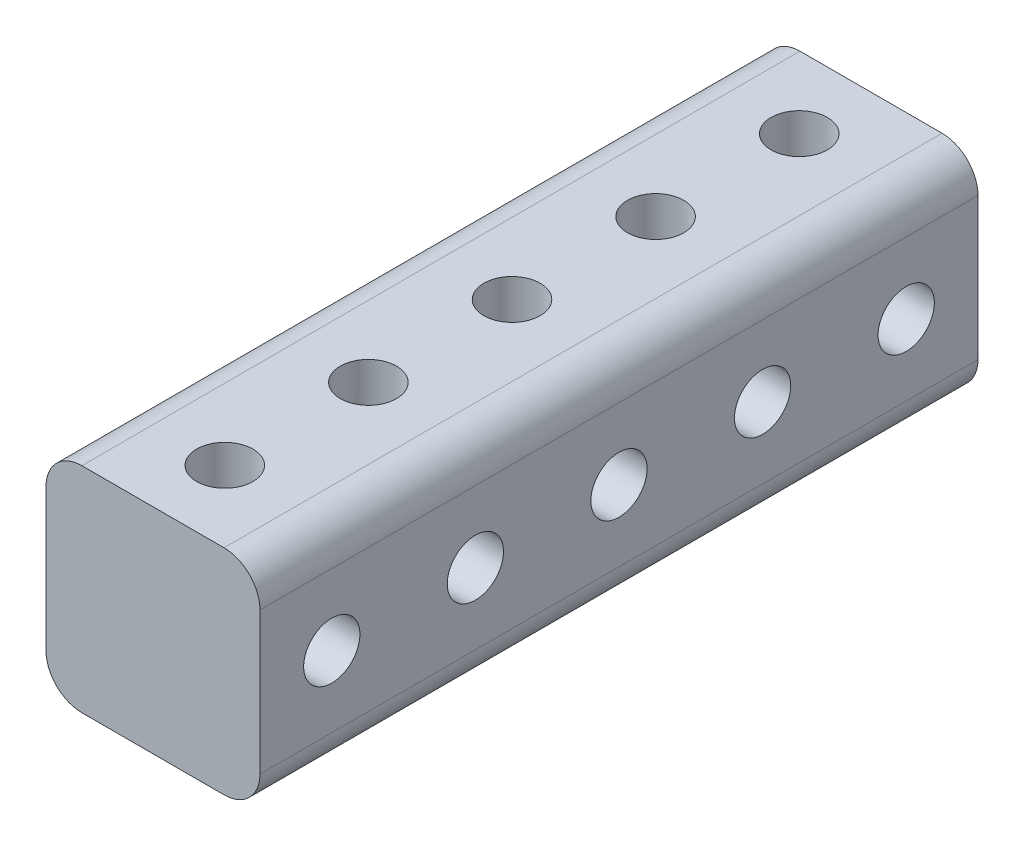
from build123d import *

# Parameters (mm, degrees)
SKETCH1_W           = 18.923
SKETCH1_H           = 18.923
BOSS_EXTRUDE1_DEPTH = 63.5
FILLET1_R           = 3.175
SKETCH2_R           = 2.4892
CUT_EXTRUDE1_DEPTH  = 63.5
SKETCH3_R           = 2.4892
CUT_EXTRUDE2_DEPTH  = 63.5


with BuildPart() as part:
    # Sketch1 → Boss-Extrude1 (new body)
    with BuildSketch(Plane.XY):
        with Locations((9.4615, 9.4615)):
            Rectangle(SKETCH1_W, SKETCH1_H)
    extrude(amount=BOSS_EXTRUDE1_DEPTH)

    # Fillet1
    fillet1_edges = [part.edges().sort_by_distance(p)[0] for p in [
        (0, 18.923, 31.75),
        (18.923, 0, 31.75),
        (0, 0, 31.75),
        (18.923, 18.923, 31.75),
    ]]
    fillet(fillet1_edges, radius=FILLET1_R)

    # Sketch2 → Cut-Extrude1 (cut)
    with BuildSketch(Plane(origin=(0, 18.923, 0), x_dir=(1, 0, 0), z_dir=(0, 1, 0))):
        with Locations((9.4615, -6.35)):
            Circle(SKETCH2_R)
        with Locations((9.4615, -19.05)):
            Circle(SKETCH2_R)
        with Locations((9.4615, -31.75)):
            Circle(SKETCH2_R)
        with Locations((9.4615, -44.45)):
            Circle(SKETCH2_R)
        with Locations((9.4615, -57.15)):
            Circle(SKETCH2_R)
    extrude(amount=-CUT_EXTRUDE1_DEPTH, mode=Mode.SUBTRACT)

    # Sketch3 → Cut-Extrude2 (cut)
    with BuildSketch(Plane(origin=(18.923, 0, 0), x_dir=(0, 0, -1), z_dir=(1, 0, 0))):
        with Locations((-57.15, 9.4615)):
            Circle(SKETCH3_R)
        with Locations((-44.45, 9.4615)):
            Circle(SKETCH3_R)
        with Locations((-31.75, 9.4615)):
            Circle(SKETCH3_R)
        with Locations((-19.05, 9.4615)):
            Circle(SKETCH3_R)
        with Locations((-6.35, 9.4615)):
            Circle(SKETCH3_R)
    extrude(amount=-CUT_EXTRUDE2_DEPTH, mode=Mode.SUBTRACT)


solid = part.part
